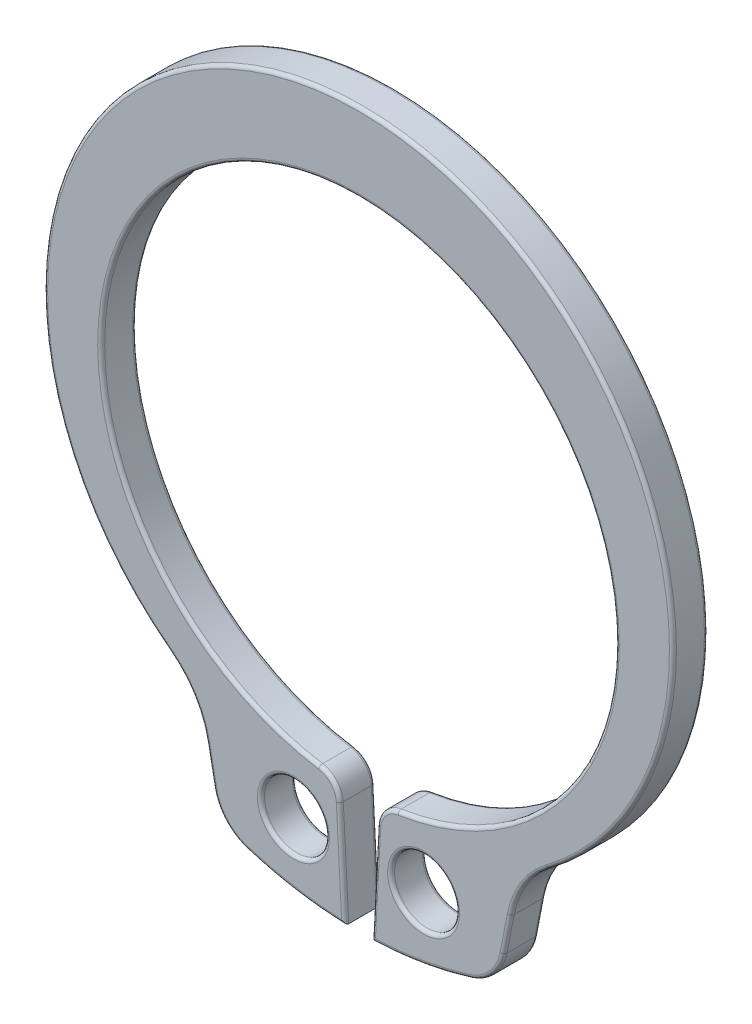
from build123d import *

# Parameters (mm, degrees)
SKETCH2_R           = 0.927
BOSS_EXTRUDE1_DEPTH = 0.5
FILLET1_R           = 2.787374056
FILLET2_R           = 1.393687028
FILLET3_R           = 0.696843514
FILLET4_R           = 0.1


with BuildPart() as part:
    # Sketch2 → Boss-Extrude1 (new, symmetric)
    with BuildSketch(Plane.XY):
        with BuildLine():
            Line((-3.9913688, -10.101667701), (-4.567334288, -7.130078103))
            ThreePointArc((-4.567334288, -7.130078103), (-8.663924897, 2.97084317), (0, 9.585))
            Line((0, 9.585), (0, 7.35))
            ThreePointArc((0, 7.35), (-7.344582346, 0.282152728), (-0.56388951, -7.328337371))
            Line((-0.56388951, -7.328337371), (-0.379064953, -10.855))
            ThreePointArc((-0.379064953, -10.855), (-2.217442262, -10.632857803), (-3.9913688, -10.101667701))
        make_face()
        with Locations((-1.858987009, -8.91402895)):
            Circle(SKETCH2_R, mode=Mode.SUBTRACT)
    extrude(amount=BOSS_EXTRUDE1_DEPTH, both=True)

    # Fillet1
    fillet1_edges = [part.edges().sort_by_distance(p)[0] for p in [
        (-4.567334288, -7.130078103, 0),
    ]]
    fillet(fillet1_edges, radius=FILLET1_R)

    # Fillet2
    fillet2_edges = [part.edges().sort_by_distance(p)[0] for p in [
        (-3.9913688, -10.101667701, 0),
    ]]
    fillet(fillet2_edges, radius=FILLET2_R)

    # Fillet3
    fillet3_edges = [part.edges().sort_by_distance(p)[0] for p in [
        (-0.56388951, -7.328337371, 0),
    ]]
    fillet(fillet3_edges, radius=FILLET3_R)

    # Mirror1: part across plane


with BuildPart() as part_1:
    add(part.part)
    add(part.part.mirror(Plane(origin=(0, 9.585, 0.5), x_dir=(0, 0, 1), z_dir=(-1, 0, 0))))

    # Fillet4
    fillet4_edges = [part_1.edges().sort_by_distance(p)[0] for p in [
        (4.719621728, -7.318395535, -0.5),
        (4.245449296, -8.790785411, -0.5),
        (3.811503464, -9.983954028, -0.5),
        (1.796840548, -10.711959638, -0.5),
        (7.328411112, 0.56293034, -0.5),
        (-1.796840548, -10.711959638, -0.5),
        (-3.811503464, -9.983954028, -0.5),
        (-4.245449296, -8.790785411, -0.5),
        (-4.719621728, -7.318395535, -0.5),
        (4.719621728, -7.318395535, 0.5),
        (4.245449296, -8.790785411, 0.5),
        (3.811503464, -9.983954028, 0.5),
        (1.796840548, -10.711959638, 0.5),
        (0, 7.35, 0.5),
        (-1.796840548, -10.711959638, 0.5),
        (-3.811503464, -9.983954028, 0.5),
        (-4.245449296, -8.790785411, 0.5),
        (-4.719621728, -7.318395535, 0.5),
        (8.517222912, 3.453900117, -0.5),
        (8.517222912, 3.453900117, 0.5),
        (0.456078981, -9.385484794, -0.5),
        (0.712001326, -7.485189778, -0.5),
        (-0.712001326, -7.485189778, -0.5),
        (-0.456078981, -9.385484794, -0.5),
        (0.456078981, -9.385484794, 0.5),
        (0.712001326, -7.485189778, 0.5),
        (-0.712001326, -7.485189778, 0.5),
        (-0.456078981, -9.385484794, 0.5),
        (2.785987009, -8.91402895, -0.5),
        (-2.785987009, -8.91402895, -0.5),
        (2.785987009, -8.91402895, 0.5),
        (-2.785987009, -8.91402895, 0.5),
    ]]
    fillet(fillet4_edges, radius=FILLET4_R)


solid = part_1.part
